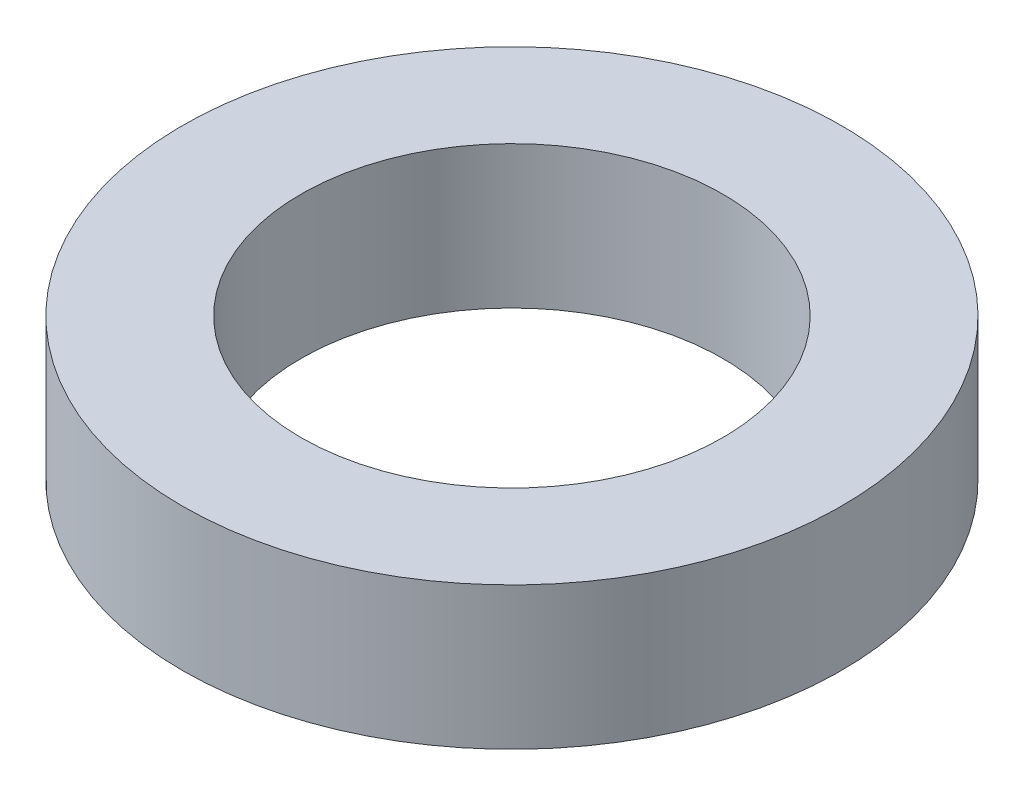
from build123d import *

# Parameters (mm, degrees)
SKETCH1_R           = 62.5
BOSS_EXTRUDE1_DEPTH = 27
SKETCH2_R           = 40
CUT_EXTRUDE1_DEPTH  = 93.420235879


with BuildPart() as part:
    # Sketch1 → Boss-Extrude1 (new body)
    with BuildSketch(Plane(origin=(0, 0, 0), x_dir=(1, 0, 0), z_dir=(0, 1, 0))):
        Circle(SKETCH1_R)
    extrude(amount=BOSS_EXTRUDE1_DEPTH)

    # Sketch2 → Cut-Extrude1 (cut, through all)
    with BuildSketch(Plane(origin=(0, 0, 0), x_dir=(1, 0, 0), z_dir=(0, 1, 0))):
        Circle(SKETCH2_R)
    extrude(amount=CUT_EXTRUDE1_DEPTH, mode=Mode.SUBTRACT)


solid = part.part
